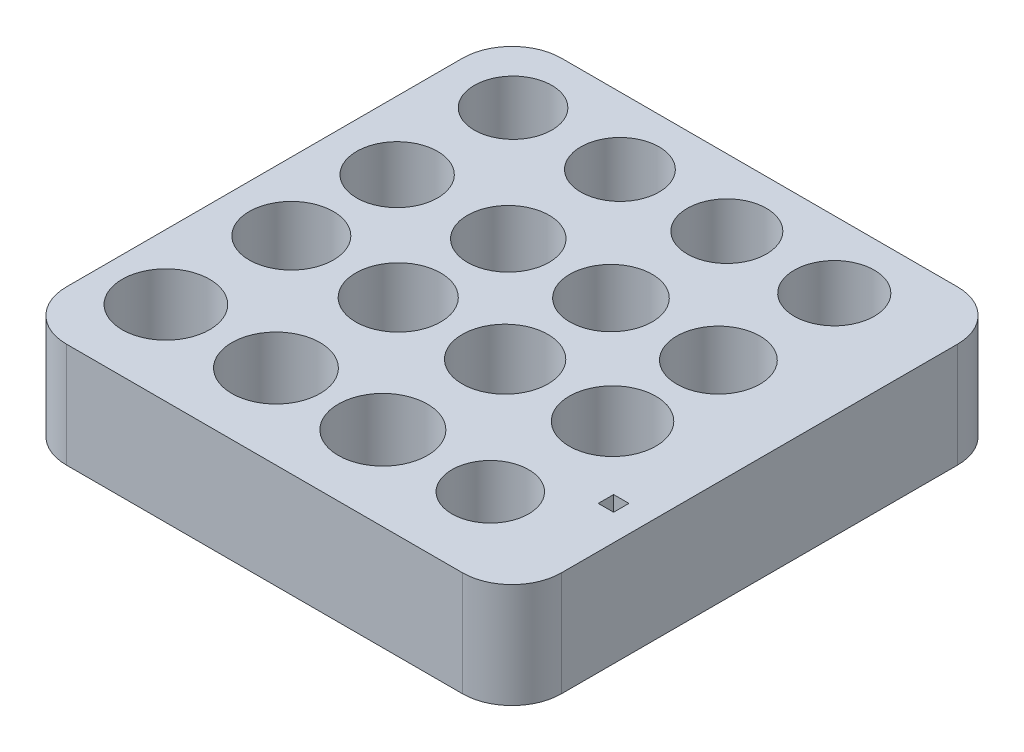
from build123d import *

# Parameters (mm, degrees)
BOSS_EXTRUDE1_DEPTH = 6.35
SKETCH2_R           = 2.35
SKETCH2_R_2         = 2.4
SKETCH2_R_3         = 2.45
SKETCH2_R_4         = 2.5
SKETCH2_R_5         = 2.375
SKETCH2_R_6         = 2.425
SKETCH2_R_7         = 2.475
SKETCH2_R_8         = 2.525
SKETCH2_R_9         = 2.55
SKETCH2_R_10        = 2.575
SKETCH2_R_11        = 2.6
SKETCH2_R_12        = 2.625
SKETCH2_R_13        = 2.65
SKETCH2_R_14        = 2.675
SKETCH2_R_15        = 2.7
SKETCH2_R_16        = 2.325
SKETCH2_W           = 0.929848637
SKETCH2_H           = 0.929848637
CUT_EXTRUDE1_DEPTH  = 6.35


with BuildPart() as part:
    # Sketch1 → Boss-Extrude1 (new body)
    with BuildSketch(Plane(origin=(0, 0, 0), x_dir=(1, 0, 0), z_dir=(0, 1, 0))):
        with BuildLine():
            Line((3, 0), (27, 0))
            ThreePointArc((27, 0), (29.121320344, 0.878679656), (30, 3))
            Line((30, 3), (30, 27))
            ThreePointArc((30, 27), (29.121320344, 29.121320344), (27, 30))
            Line((27, 30), (3, 30))
            ThreePointArc((3, 30), (0.878679656, 29.121320344), (0, 27))
            Line((0, 27), (0, 3))
            ThreePointArc((0, 3), (0.878679656, 0.878679656), (3, 0))
        make_face()
    extrude(amount=BOSS_EXTRUDE1_DEPTH)

    # Sketch2 → Cut-Extrude1 (cut)
    with BuildSketch(Plane(origin=(0, 6.35, 0), x_dir=(1, 0, 0), z_dir=(0, 1, 0))):
        with Locations((4.130390075, 25.933737418)):
            Circle(SKETCH2_R)
        with Locations((17.084143496, 25.933737418)):
            Circle(SKETCH2_R_2)
        with Locations((4.130390075, 18.911777023)):
            Circle(SKETCH2_R_3)
        with Locations((17.084143496, 18.911777023)):
            Circle(SKETCH2_R_4)
        with Locations((10.607266785, 25.933737418)):
            Circle(SKETCH2_R_5)
        with Locations((23.593083953, 25.933737418)):
            Circle(SKETCH2_R_6)
        with Locations((10.863776754, 18.911777023)):
            Circle(SKETCH2_R_7)
        with Locations((23.593083953, 18.911777023)):
            Circle(SKETCH2_R_8)
        with Locations((4.130390075, 12.499027805)):
            Circle(SKETCH2_R_9)
        with Locations((10.607266785, 12.499027805)):
            Circle(SKETCH2_R_10)
        with Locations((17.084143496, 12.499027805)):
            Circle(SKETCH2_R_11)
        with Locations((23.593083953, 12.499027805)):
            Circle(SKETCH2_R_12)
        with Locations((3.938007598, 5.092302457)):
            Circle(SKETCH2_R_13)
        with Locations((10.607266785, 5.092302457)):
            Circle(SKETCH2_R_14)
        with Locations((17.084143496, 5.092302457)):
            Circle(SKETCH2_R_15)
        with Locations((23.593083953, 5.092302457)):
            Circle(SKETCH2_R_16)
        with Locations((27.937721549, 8.218517702)):
            Rectangle(SKETCH2_W, SKETCH2_H)
    extrude(amount=-CUT_EXTRUDE1_DEPTH, mode=Mode.SUBTRACT)


solid = part.part
